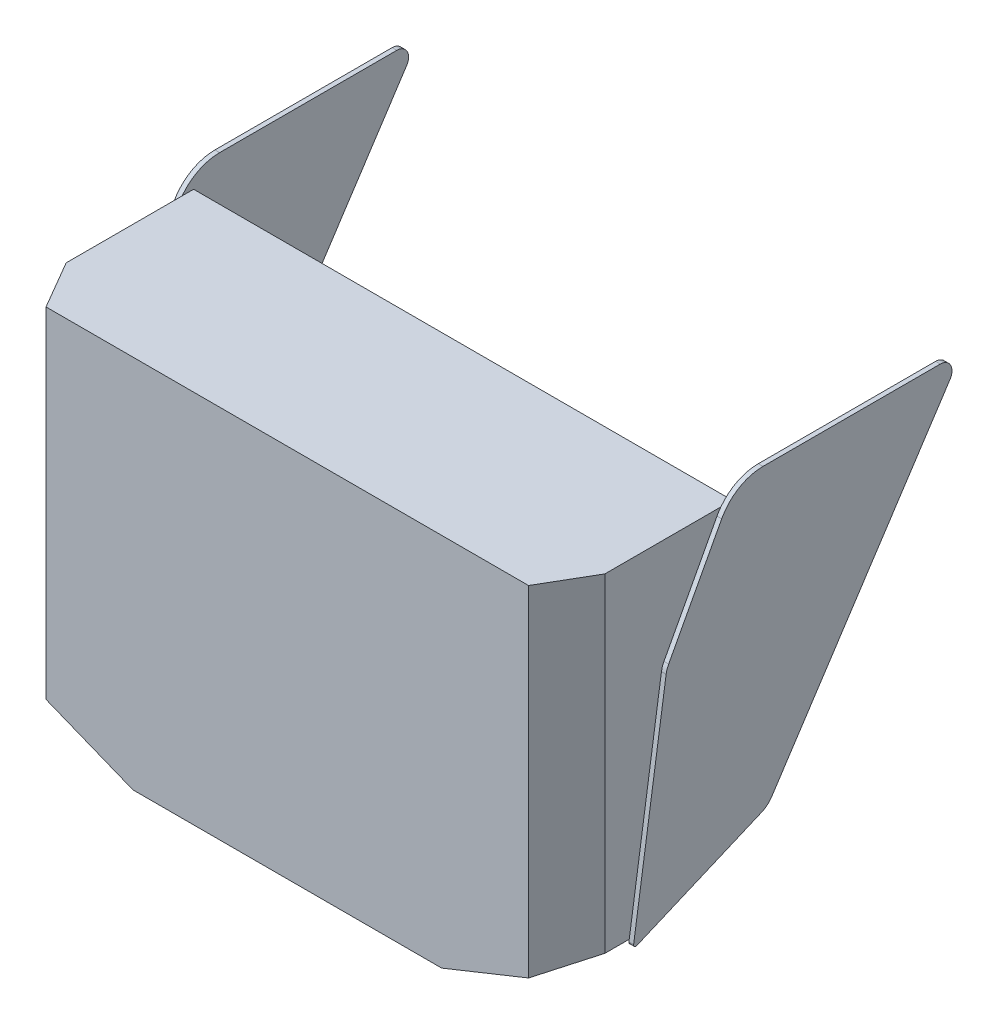
from build123d import *

# Parameters (mm, degrees)
BOSS_EXTRUDE1_DEPTH     = 75
CUT_EXTRUDE1_DEPTH      = 159.902485821
CUT_EXTRUDE1_DEPTH_BACK = 159.902485821
CUT_EXTRUDE2_DEPTH      = 159.902485821
CUT_EXTRUDE2_DEPTH_BACK = 159.902485821
BOSS_EXTRUDE3_START     = 115
BOSS_EXTRUDE3_DEPTH     = 2
BOSS_EXTRUDE5_START     = -115
BOSS_EXTRUDE5_DEPTH     = 2
FILLET3_R               = 5
FILLET4_R               = 20
FILLET5_R               = 10
FILLET6_R               = 10
FILLET7_R               = 10
FILLET8_R               = 10
FILLET11_R              = 1
BOSS_EXTRUDE6_REACH     = 266.055
SKETCH7_W               = 79.88
SKETCH7_H               = 51.8
FILLET13_R              = 5


with BuildPart() as part:
    # Sketch2 → Boss-Extrude1 (new body)
    with BuildSketch(Plane.XY):
        Polygon((-115, -60.3), (-65.9, -80), (65.9, -80), (115, -60.3), (115, 80), (-115, 80), align=None)
    extrude(amount=-BOSS_EXTRUDE1_DEPTH)

    # Sketch3 → Cut-Extrude1 (cut, two sides: drawn at the far end of the back side and taken through both)
    with BuildSketch(Plane(origin=(0, 0, 0), x_dir=(0, 0, -1), z_dir=(1, 0, 0)).offset(-CUT_EXTRUDE1_DEPTH_BACK)):
        Polygon((0, -80), (75, -38.15), (75, -80), align=None)
    extrude(amount=CUT_EXTRUDE1_DEPTH + CUT_EXTRUDE1_DEPTH_BACK, mode=Mode.SUBTRACT)

    # Sketch4 → Cut-Extrude2 (cut, two sides: drawn at the far end of the back side and taken through both)
    with BuildSketch(Plane(origin=(0, 0, 0), x_dir=(1, 0, 0), z_dir=(0, 1, 0)).offset(-CUT_EXTRUDE2_DEPTH_BACK)):
        Polygon((-115, 20.6), (-103, 0), (-115, 0), align=None)
        Polygon((115, 20.6), (103, 0), (115, 0), align=None)
    extrude(amount=CUT_EXTRUDE2_DEPTH + CUT_EXTRUDE2_DEPTH_BACK, mode=Mode.SUBTRACT)

    # Sketch5 → Boss-Extrude3 (add)
    with BuildSketch(Plane(origin=(0, 0, 0), x_dir=(0, 0, -1), z_dir=(1, 0, 0)).offset(BOSS_EXTRUDE3_START)):
        Polygon((30.6, -62.9252), (88.18, -38.439520512), (171.03, 87.993161576), (74.11, 87.993161576), (45, 33.512515472), align=None)
    extrude(amount=BOSS_EXTRUDE3_DEPTH)

    # Sketch6 → Boss-Extrude5 (add)
    with BuildSketch(Plane(origin=(0, 0, 0), x_dir=(0, 0, -1), z_dir=(1, 0, 0)).offset(BOSS_EXTRUDE5_START)):
        Polygon((30.6, -62.9252), (88.18, -38.439520512), (171.03, 87.993161576), (74.11, 87.993161576), (45, 33.512515472), align=None)
    extrude(amount=-BOSS_EXTRUDE5_DEPTH)

    # Fillet3
    fillet3_edges = [part.edges().sort_by_distance(p)[0] for p in [
        (116, 87.993161576, -171.03),
        (-116, 87.993161576, -171.03),
    ]]
    fillet(fillet3_edges, radius=FILLET3_R)

    # Fillet4
    # the kernel refuses this fillet: 20 mm, written as the material it takes off along each edge
    with BuildSketch(Plane(origin=(115, 87.993161576, -74.11), x_dir=(0, -0.8819920042873963, 0.4712643678160927), z_dir=(1, 0, 0)), Plane(origin=(-115, 87.993161576, -74.11), x_dir=(0, 0, -1), z_dir=(-1, 0, 0))) as fillet4_piece_1:
        with BuildLine():
            CenterArc((FILLET4_R * 0.599478940414, FILLET4_R), FILLET4_R, 208.116400727, 61.883599273)
            Line((-FILLET4_R * 0.282513063873, FILLET4_R * 0.528735632184), (0, 0))
            Line((0, 0), (FILLET4_R * 0.599478940414, 0))
        make_face()
    extrude(amount=31.973947021, mode=Mode.SUBTRACT)

    # Fillet5
    fillet5_edges = [part.edges().sort_by_distance(p)[0] for p in [
        (116, 33.512515472, -45),
    ]]
    fillet(fillet5_edges, radius=FILLET5_R)

    # Fillet6
    fillet6_edges = [part.edges().sort_by_distance(p)[0] for p in [
        (-116, -38.439520512, -88.18),
    ]]
    fillet(fillet6_edges, radius=FILLET6_R)

    # Fillet7
    fillet7_edges = [part.edges().sort_by_distance(p)[0] for p in [
        (-116, 33.512515472, -45),
    ]]
    fillet(fillet7_edges, radius=FILLET7_R)

    # Fillet8
    fillet8_edges = [part.edges().sort_by_distance(p)[0] for p in [
        (116, -38.439520512, -88.18),
    ]]
    fillet(fillet8_edges, radius=FILLET8_R)

    # Fillet11
    fillet11_edges = [part.edges().sort_by_distance(p)[0] for p in [
        (116, -62.9252, -30.6),
        (-116, -62.9252, -30.6),
    ]]
    fillet(fillet11_edges, radius=FILLET11_R)

    # Sketch7 → Boss-Extrude6 (add, up to next)
    with BuildSketch(Plane(origin=(0, -80, 0), x_dir=(-1, 0, 0), z_dir=(0, -1, 0)), mode=Mode.PRIVATE) as boss_extrude6_sk1:
        with Locations((0, 25.9)):
            Rectangle(SKETCH7_W, SKETCH7_H)
    boss_extrude6_tool1 = extrude(boss_extrude6_sk1.sketch, amount=-BOSS_EXTRUDE6_REACH, mode=Mode.PRIVATE) - part.part
    add(boss_extrude6_tool1.solids().sort_by_distance((0, -80, -25.9))[0])

    # Fillet13
    fillet13_edges = [part.edges().sort_by_distance(p)[0] for p in [
        (39.94, -65.5478, -51.8),
        (-39.94, -65.5478, -51.8),
    ]]
    fillet(fillet13_edges, radius=FILLET13_R)


solid = part.part
